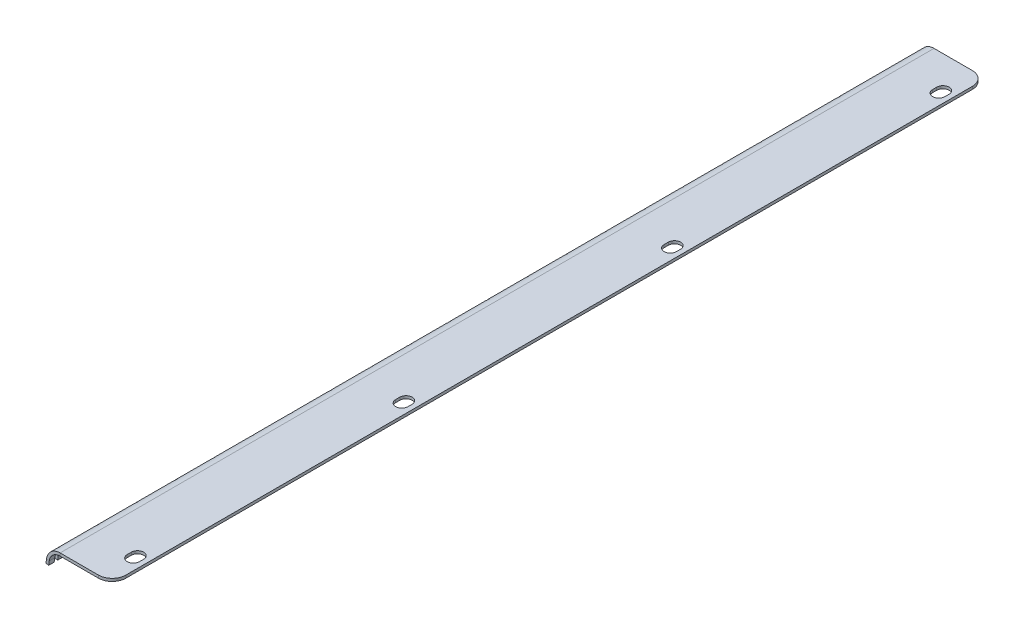
from build123d import *

# Parameters (mm, degrees)
BASE_FLANGE1_DEPTH = 319
FILLET1_R          = 10
KESKIREIK_DEPTH    = 2
LPATTERN4_COUNT    = 4
LPATTERN4_PITCH    = 196
SKETCH5_W          = 6.3
SKETCH5_H          = 2.5
AISI_DEPTH         = 323.789541935
LPATTERN3_COUNT    = 21
LPATTERN3_PITCH    = 28.5


# Sheet-metal steps are written as plain solids
with BuildPart() as part:
    # Sketch1 → Base-Flange1 (new, symmetric)
    with BuildSketch(Plane.XY):
        with BuildLine():
            Line((0, 0), (-38, 0))
            ThreePointArc((-38, 0), (-43.291502622, -2), (-45.937253933, -7))
            Line((-45.937253933, -7), (-46.312253933, -9.976470225))
            Line((-46.312253933, -9.976470225), (-48.296567416, -9.726470225))
            Line((-48.296567416, -9.726470225), (-47.921567416, -6.75))
            ThreePointArc((-47.921567416, -6.75), (-44.614378278, -0.5), (-38, 2))
            Line((-38, 2), (0, 2))
            Line((0, 2), (0, 0))
        make_face()
    extrude(amount=BASE_FLANGE1_DEPTH, both=True)

    # Fillet1
    fillet1_edges = [part.edges().sort_by_distance(p)[0] for p in [
        (0, 1, 319),
        (0, 1, -319),
    ]]
    fillet(fillet1_edges, radius=FILLET1_R)

    # Sketch4 → Keskireikä (cut)
    with BuildSketch(Plane(origin=(0, 2, 0), x_dir=(1, 0, 0), z_dir=(0, 1, 0))):
        with BuildLine():
            Line((-12.5, -295.5), (-12.5, -292.5))
            ThreePointArc((-12.5, -292.5), (-8, -288), (-3.5, -292.5))
            Line((-3.5, -292.5), (-3.5, -295.5))
            ThreePointArc((-3.5, -295.5), (-8, -300), (-12.5, -295.5))
        make_face()
    keskireik = extrude(amount=-KESKIREIK_DEPTH, mode=Mode.SUBTRACT)

    # LPattern4: Keskireikä ×4
    with Locations(*[(0, 0, -i * LPATTERN4_PITCH) for i in range(1, LPATTERN4_COUNT)]):
        add(keskireik, mode=Mode.SUBTRACT)

    # Sketch5 → AISI (cut, through all)
    with BuildSketch(Plane(origin=(0, 0, 0), x_dir=(1, 0, 0), z_dir=(0, 1, 0))):
        with Locations((-45.146567416, -313.75)):
            Rectangle(SKETCH5_W, SKETCH5_H)
    aisi = extrude(amount=-AISI_DEPTH, mode=Mode.SUBTRACT)

    # LPattern3: AISI ×21
    with Locations(*[(0, 0, -i * LPATTERN3_PITCH) for i in range(1, LPATTERN3_COUNT)]):
        add(aisi, mode=Mode.SUBTRACT)


solid = part.part
